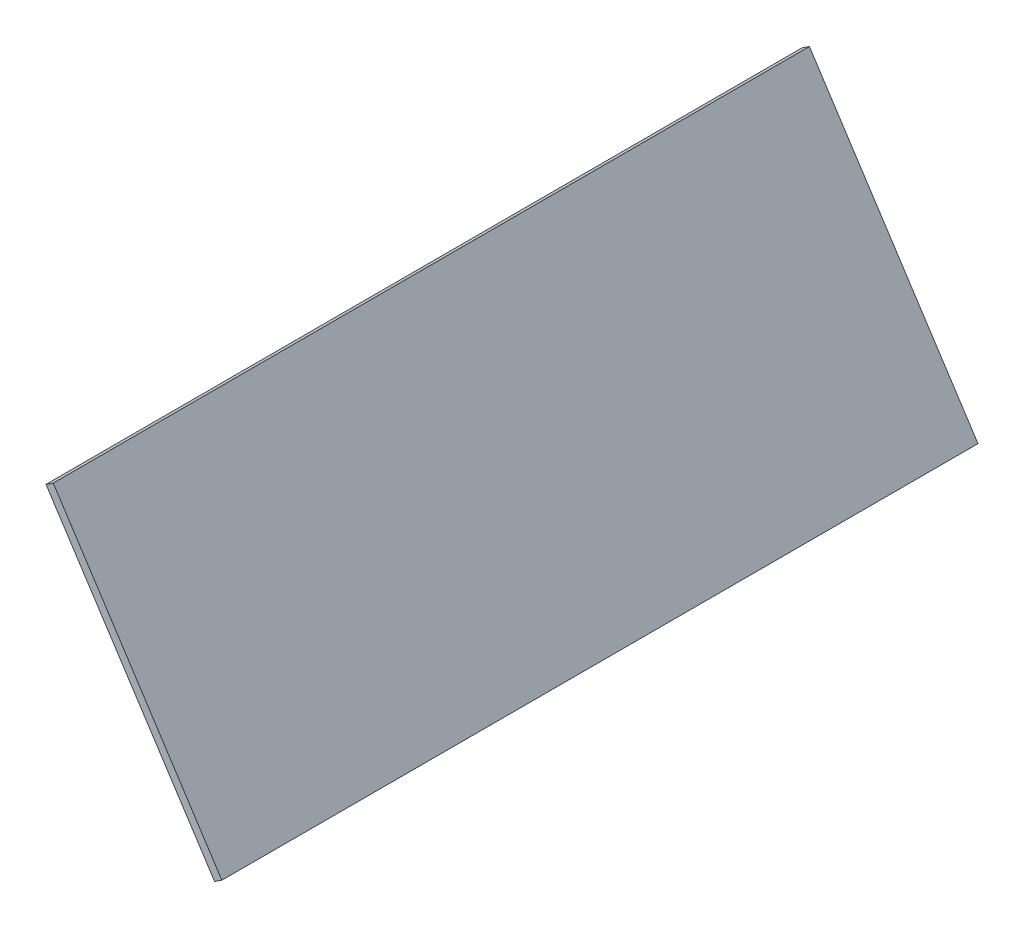
from build123d import *

# Parameters (mm, degrees)
BOSS_EXTRUDE1_DEPTH = 277.48


with BuildPart() as part:
    # Sketch1 → Boss-Extrude1 (new body)
    with BuildSketch(Plane.XY):
        Polygon((-207.833204322, 9.507372566), (-145.962209944, -85.765603953), (-148.624988997, -87.494832889), (-210.495983375, 7.778143629), align=None)
    extrude(amount=BOSS_EXTRUDE1_DEPTH)


solid = part.part
